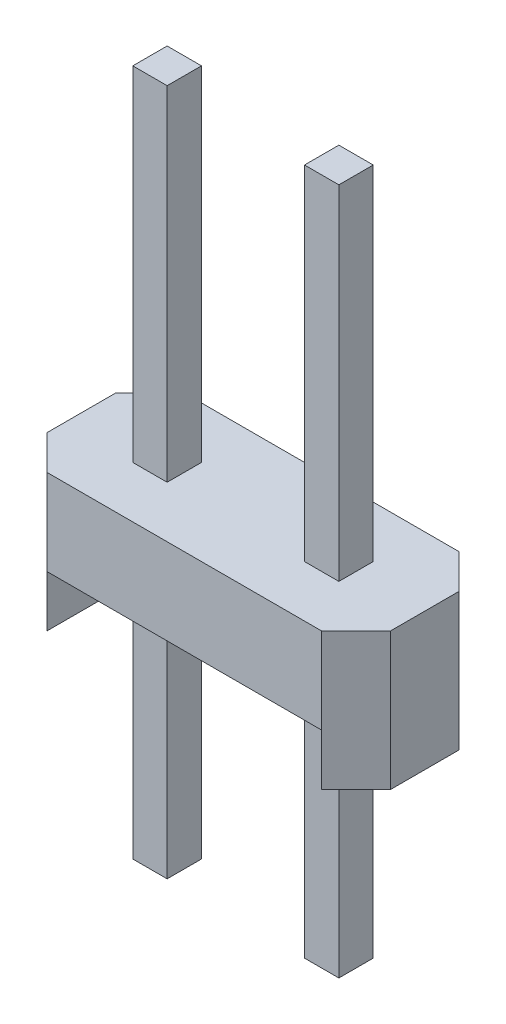
from build123d import *

# Parameters (mm, degrees)
SKETCH1_W                = 5
SKETCH1_H                = 2
BOSS_EXTRUDE1_DEPTH      = 2
SKETCH2_W                = 4
SKETCH2_H                = 0.75
CUT_EXTRUDE1_DEPTH       = 6.744562647
CHAMFER1_START           = -1.060660172
CHAMFER1_OUTLINE_W       = 1.403805922
CHAMFER1_OUTLINE_H       = 3
CHAMFER1_OUTLINE_W_2     = 1.353553391
CHAMFER1_DEPTH           = 4.242640687
CHAMFER1_START_2         = 3.181980515
CHAMFER1_2_OUTLINE_W     = 4.242640687
CHAMFER1_2_OUTLINE_H     = 3
CHAMFER1_2_DEPTH         = 1.818019485
CHAMFER1_START_3         = -1.414213562
CHAMFER1_3_OUTLINE_W     = 4.242640687
CHAMFER1_3_OUTLINE_H     = 3
CHAMFER1_3_DEPTH         = 0.35355339
BOSS_EXTRUDE2_DEPTH      = 5
BOSS_EXTRUDE2_DEPTH_BACK = 5
SKETCH3_W                = 0.5
SKETCH3_H                = 0.5


with BuildPart() as part:
    # Sketch1 → Boss-Extrude1 (new body)
    with BuildSketch(Plane(origin=(0, 0, 0), x_dir=(1, 0, 0), z_dir=(0, 1, 0))):
        with Locations((2.5, 1)):
            Rectangle(SKETCH1_W, SKETCH1_H)
    extrude(amount=BOSS_EXTRUDE1_DEPTH)

    # Sketch2 → Cut-Extrude1 (cut, through all)
    with BuildSketch(Plane.XY):
        with Locations((2.5, 0.375)):
            Rectangle(SKETCH2_W, SKETCH2_H)
    extrude(amount=-CUT_EXTRUDE1_DEPTH, mode=Mode.SUBTRACT)

    # Chamfer1: read off the stored shape, not the designer's step
    # Chamfer1 outline → Chamfer1 (cut)
    with BuildSketch(Plane(origin=(0, 0, 0), x_dir=(0.707106781186549, 0, -0.707106781186546), z_dir=(0.707106781186546, 0, 0.707106781186549)).offset(CHAMFER1_START)):
        with Locations((5.298097039, 1.5)):
            Rectangle(CHAMFER1_OUTLINE_W, CHAMFER1_OUTLINE_H)
        with Locations((-0.323223305, 1.5)):
            Rectangle(CHAMFER1_OUTLINE_W_2, CHAMFER1_OUTLINE_H)
    extrude(amount=CHAMFER1_DEPTH, mode=Mode.SUBTRACT)

    # Chamfer1 2 outline → Chamfer1 2 (cut)
    with BuildSketch(Plane(origin=(0, 0, 0), x_dir=(0.707106781186549, 0, -0.707106781186546), z_dir=(0.707106781186546, 0, 0.707106781186549)).offset(CHAMFER1_START_2)):
        with Locations((2.474873735, 1.5)):
            Rectangle(CHAMFER1_2_OUTLINE_W, CHAMFER1_2_OUTLINE_H)
    extrude(amount=CHAMFER1_2_DEPTH, mode=Mode.SUBTRACT)

    # Chamfer1 3 outline → Chamfer1 3 (cut)
    with BuildSketch(Plane(origin=(0, 0, 0), x_dir=(0.707106781186549, 0, -0.707106781186546), z_dir=(0.707106781186546, 0, 0.707106781186549)).offset(CHAMFER1_START_3)):
        with Locations((2.474873735, 1.5)):
            Rectangle(CHAMFER1_3_OUTLINE_W, CHAMFER1_3_OUTLINE_H)
    extrude(amount=CHAMFER1_3_DEPTH, mode=Mode.SUBTRACT)

    # Sketch3 → Boss-Extrude2 (add, two sides: drawn at the far end of the back side and taken through both)
    with BuildSketch(Plane(origin=(0, 2, 0), x_dir=(1, 0, 0), z_dir=(0, 1, 0)).offset(-BOSS_EXTRUDE2_DEPTH_BACK)):
        with Locations((1.25, 1)):
            Rectangle(SKETCH3_W, SKETCH3_H)
        with Locations((3.75, 1)):
            Rectangle(SKETCH3_W, SKETCH3_H)
    extrude(amount=BOSS_EXTRUDE2_DEPTH + BOSS_EXTRUDE2_DEPTH_BACK)


solid = part.part
